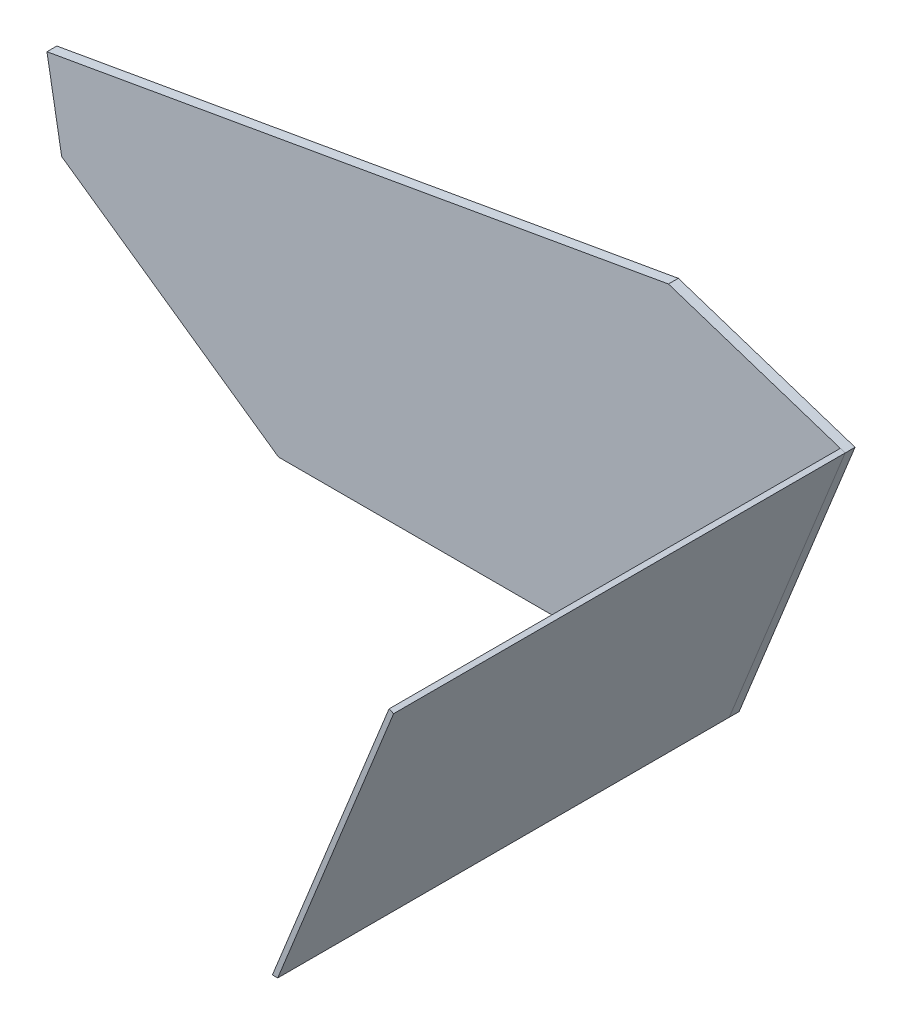
from build123d import *

# Parameters (mm, degrees)
BOSS_EXTRUDE1_DEPTH = 290
BOSS_EXTRUDE2_DEPTH = 6.35


with BuildPart() as part:
    # Sketch1 → Boss-Extrude1 (new body)
    with BuildSketch(Plane.XY):
        Polygon((140, 0), (143.424347808, 0), (217.865127421, 184.247394979), (214.921318683, 185.436770913), align=None)
    extrude(amount=BOSS_EXTRUDE1_DEPTH)


with BuildPart() as body_2:
    # Sketch2 → Boss-Extrude2 (new body)
    with BuildSketch(Plane.XY):
        Polygon((-294.777867348, 151.108031048), (104.369939009, 221.488558599), (217.865127421, 184.247394979), (143.424347808, 0), (-146.070887152, 0), (-285.326734681, 97.50799418), align=None)
    extrude(amount=-BOSS_EXTRUDE2_DEPTH)


solid = Compound([part.part, body_2.part])
